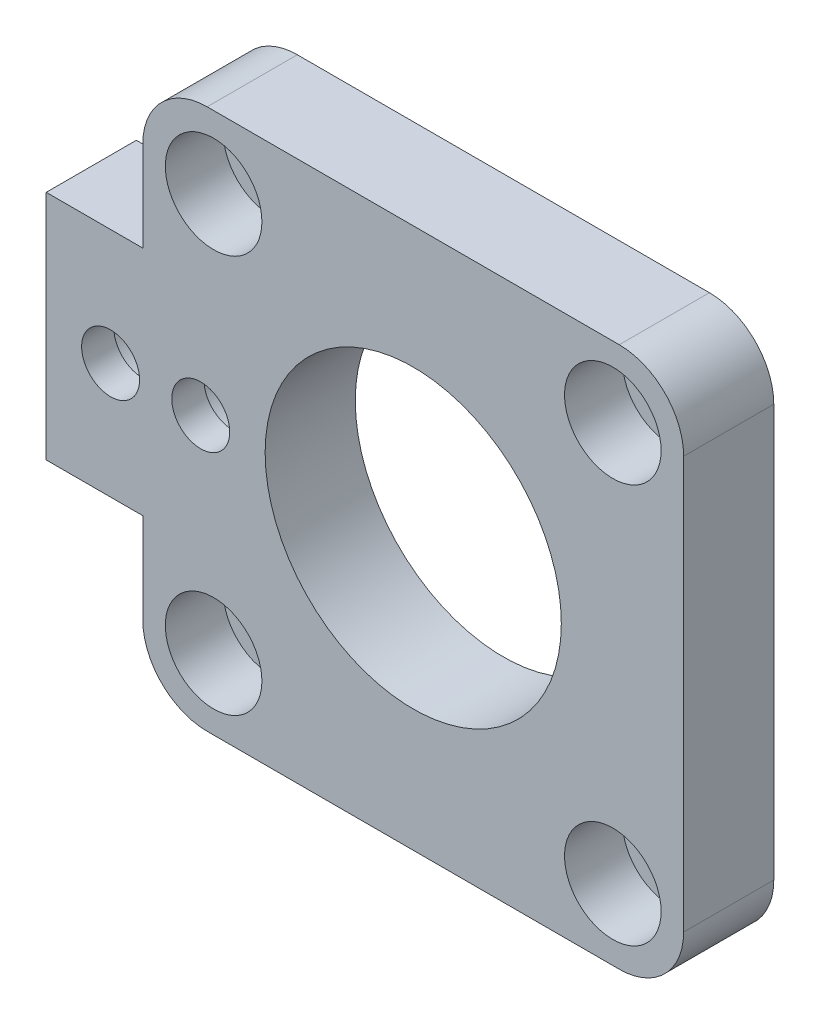
from build123d import *

# Parameters (mm, degrees)
ESQUISSE1_R             = 1.75
ESQUISSE1_R_2           = 11.5
BOSS_EXTRU_1_DEPTH      = 7
ESQUISSE9_R             = 2.25
ENL_V_MAT_EXTRU_2_DEPTH = 17
ENL_V_START             = -4.5
ESQUISSE10_R            = 2.25
ENL_V_MAT_EXTRU_3_DEPTH = 4.5
ESQUISSE11_R            = 3.75
ENL_V_MAT_EXTRU_4_DEPTH = 4.5
CONG_1_R                = 5


with BuildPart() as part:
    # Esquisse1 → Boss.-Extru.1 (new body)
    with BuildSketch(Plane.XY):
        Polygon((0, -42), (0, 0), (-42, 0), (-42, -12), (-49.5, -12), (-49.5, -30), (-42, -30), (-42, -42), align=None)
        with Locations((-36.5, -36.5)):
            Circle(ESQUISSE1_R, mode=Mode.SUBTRACT)
        with Locations((-5.5, -36.5)):
            Circle(ESQUISSE1_R, mode=Mode.SUBTRACT)
        with Locations((-36.5, -5.611040912)):
            Circle(ESQUISSE1_R, mode=Mode.SUBTRACT)
        with Locations((-21, -21)):
            Circle(ESQUISSE1_R_2, mode=Mode.SUBTRACT)
        with Locations((-5.5, -5.5)):
            Circle(ESQUISSE1_R, mode=Mode.SUBTRACT)
    extrude(amount=BOSS_EXTRU_1_DEPTH)

    # Esquisse9 → Enlèv. mat.-Extru.2 (cut)
    with BuildSketch(Plane.XY.offset(7)):
        with Locations((-44.5, -21)):
            Circle(ESQUISSE9_R)
        with Locations((-37.5, -21)):
            Circle(ESQUISSE9_R)
    extrude(amount=-ENL_V_MAT_EXTRU_2_DEPTH, mode=Mode.SUBTRACT)

    # Esquisse10 → Enlèv. mat.-Extru.3 (cut)
    with BuildSketch(Plane(origin=(0, 0, 0), x_dir=(-1, 0, 0), z_dir=(0, 0, -1)).offset(ENL_V_START)):
        with BuildLine():
            ThreePointArc((41, -19.653708798), (33.75, -21), (41, -22.346291202))
            ThreePointArc((41, -22.346291202), (48.25, -21), (41, -19.653708798))
        make_face()
        with Locations((44.5, -21)):
            Circle(ESQUISSE10_R, mode=Mode.SUBTRACT)
        with Locations((37.5, -21)):
            Circle(ESQUISSE10_R, mode=Mode.SUBTRACT)
    extrude(amount=ENL_V_MAT_EXTRU_3_DEPTH, mode=Mode.SUBTRACT)

    # Esquisse11 → Enlèv. mat.-Extru.4 (cut)
    with BuildSketch(Plane.XY.offset(7)):
        with Locations((-36.5, -5.611040912)):
            Circle(ESQUISSE11_R)
        with Locations((-5.5, -5.5)):
            Circle(ESQUISSE11_R)
        with Locations((-5.5, -36.5)):
            Circle(ESQUISSE11_R)
        with Locations((-36.5, -36.5)):
            Circle(ESQUISSE11_R)
    extrude(amount=-ENL_V_MAT_EXTRU_4_DEPTH, mode=Mode.SUBTRACT)

    # Congé1
    cong_1_edges = [part.edges().sort_by_distance(p)[0] for p in [
        (-42, 0, 3.5),
        (0, 0, 3.5),
        (0, -42, 3.5),
        (-42, -42, 3.5),
    ]]
    fillet(cong_1_edges, radius=CONG_1_R)


solid = part.part
